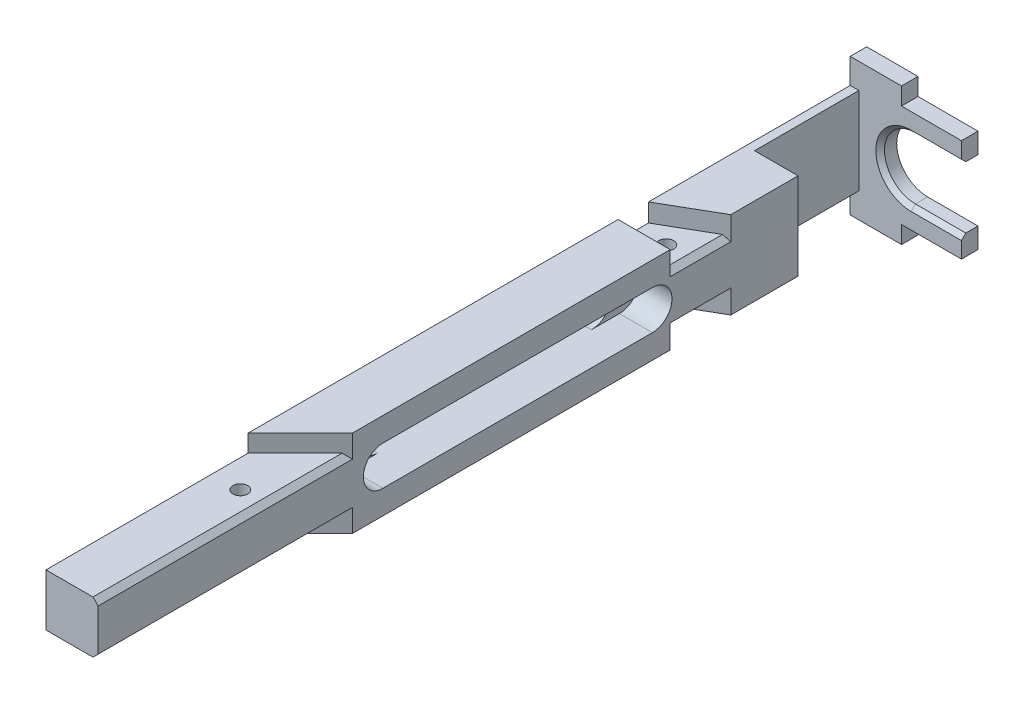
from build123d import *

# Parameters (mm, degrees)
EXTRUDE_1_DEPTH     = 6
CUT_EXTRUDE_1_DEPTH = 3.8
CUT_EXTRUDE_2_DEPTH = 49.87803699
SKETCH_3_W          = 18.536502565
SKETCH_3_H          = 15.637579157
CUT_EXTRUDE_3_DEPTH = 4
SKETCH_4_W          = 6
SKETCH_4_H          = 10
EXTRUDE_2_DEPTH     = 19.25
SKETCH_5_R          = 0.85
CUT_EXTRUDE_4_DEPTH = 50.639324129
SKETCH_7_W          = 12.8
SKETCH_7_H          = 11.8
EXTRUDE_3_DEPTH     = 1.9
SKETCH_8_W          = 12
SKETCH_8_H          = 10
CUT_EXTRUDE_5_DEPTH = 5
CUT_EXTRUDE_6_DEPTH = 5
CHAMFER_1_SIZE      = 0.5
SKETCH_10_W         = 1.9
SKETCH_10_H         = 2
EXTRUDE_4_DEPTH     = 5.9
CHAMFER_2_SIZE      = 6
CUT_EXTRUDE_7_DEPTH = 2.1
CUT_EXTRUDE_START   = -10
CUT_EXTRUDE_8_DEPTH = 2.1
CHAMFER_3_SIZE      = 0.6


with BuildPart() as part:
    # 草图1 → 凸台-拉伸1 (new body)
    with BuildSketch(Plane(origin=(0, 0, 0), x_dir=(0, 0, -1), z_dir=(1, 0, 0))):
        Polygon((-25, 5), (25, 5), (25, 3), (48.25, 3), (48.25, -3), (25, -3), (25, -5), (-25, -5), (-25, -3), (-48.25, -3), (-48.25, 3), (-25, 3), align=None)
    extrude(amount=-EXTRUDE_1_DEPTH)

    # 草图1<3> → 切除-拉伸1 (cut)
    with BuildSketch(Plane(origin=(0, 0, 0), x_dir=(0, 0, -1), z_dir=(1, 0, 0))):
        with BuildLine():
            Line((-15.5, 2.25), (15.5, 2.25))
            ThreePointArc((15.5, 2.25), (17.75, 0), (15.5, -2.25))
            Line((15.5, -2.25), (-15.5, -2.25))
            ThreePointArc((-15.5, -2.25), (-17.75, 0), (-15.5, 2.25))
        make_face()
    extrude(amount=-CUT_EXTRUDE_1_DEPTH, mode=Mode.SUBTRACT)

    # 草图1<4> → 切除-拉伸2 (cut, through all)
    with BuildSketch(Plane(origin=(0, 0, 0), x_dir=(0, 0, -1), z_dir=(1, 0, 0))):
        with BuildLine():
            Line((-12.3, 2.25), (12.3, 2.25))
            ThreePointArc((12.3, 2.25), (14.55, 0), (12.3, -2.25))
            Line((12.3, -2.25), (-12.3, -2.25))
            ThreePointArc((-12.3, -2.25), (-14.55, 0), (-12.3, 2.25))
        make_face()
    extrude(amount=-CUT_EXTRUDE_2_DEPTH, mode=Mode.SUBTRACT)

    # 草图3 → 切除-拉伸3 (cut)
    with BuildSketch(Plane(origin=(0, 0, -48.25), x_dir=(-1, 0, 0), z_dir=(0, 0, -1))):
        with Locations((1.626975839, 1.766046581)):
            Rectangle(SKETCH_3_W, SKETCH_3_H)
    extrude(amount=-CUT_EXTRUDE_3_DEPTH, mode=Mode.SUBTRACT)

    # 草图4 → 凸台-拉伸2 (add)
    with BuildSketch(Plane(origin=(0, 0, -25), x_dir=(-1, 0, 0), z_dir=(0, 0, -1))):
        with Locations((3, 0)):
            Rectangle(SKETCH_4_W, SKETCH_4_H)
    extrude(amount=EXTRUDE_2_DEPTH)

    # 草图5 → 切除-拉伸4 (cut, through all)
    with BuildSketch(Plane.XZ.offset(5)):
        with Locations(Location((-2.8, 29.1, 0), (0, 0, 270))):
            Circle(SKETCH_5_R)
        with Locations(Location((-2.8, -19.9, 0), (0, 0, 270))):
            Circle(SKETCH_5_R)
    extrude(amount=-CUT_EXTRUDE_4_DEPTH, mode=Mode.SUBTRACT)

    # 草图7 → 凸台-拉伸3 (add)
    with BuildSketch(Plane(origin=(0, 0, -44.25), x_dir=(-1, 0, 0), z_dir=(0, 0, -1))):
        with Locations((-0.4, 0)):
            Rectangle(SKETCH_7_W, SKETCH_7_H)
    extrude(amount=EXTRUDE_3_DEPTH)

    # 草图8 → 切除-拉伸5 (cut)
    with BuildSketch(Plane(origin=(0, 0, 0), x_dir=(0, 0, -1), z_dir=(1, 0, 0))):
        with Locations((38.25, 0)):
            Rectangle(SKETCH_8_W, SKETCH_8_H)
    extrude(amount=-CUT_EXTRUDE_5_DEPTH, mode=Mode.SUBTRACT)

    # 草图9 → 切除-拉伸6 (cut)
    with BuildSketch(Plane.XY.offset(-44.25)):
        with BuildLine():
            Line((12.6, -3.55), (1, -3.55))
            ThreePointArc((1, -3.55), (-2.55, 0), (1, 3.55))
            Line((1, 3.55), (12.6, 3.55))
            ThreePointArc((12.6, 3.55), (16.15, 0), (12.6, -3.55))
        make_face()
    extrude(amount=-CUT_EXTRUDE_6_DEPTH, mode=Mode.SUBTRACT)

    # 倒角1
    chamfer_1_edges = [part.edges().sort_by_distance(p)[0] for p in [
        (3.9, 3.55, -44.25),
        (3.9, -3.55, -44.25),
        (-2.55, 0, -44.25),
    ]]
    chamfer(chamfer_1_edges, length=CHAMFER_1_SIZE)

    # 草图10 → 凸台-拉伸4 (add)
    with BuildSketch(Plane.ZY.offset(6)):
        with Locations((-45.2, 6.9)):
            Rectangle(SKETCH_10_W, SKETCH_10_H)
        with Locations((-45.2, -6.9)):
            Rectangle(SKETCH_10_W, SKETCH_10_H)
    extrude(amount=-EXTRUDE_4_DEPTH)

    # 倒角2
    chamfer_2_edges = [part.edges().sort_by_distance(p)[0] for p in [
        (0, 4, 25),
        (0, -4, 25),
    ]]
    chamfer(chamfer_2_edges, length=CHAMFER_2_SIZE - 0.0001)  # a hair under: the kernel refuses the full size

    # 草图11 → 切除-拉伸7 (cut)
    with BuildSketch(Plane(origin=(0, 5, 0), x_dir=(1, 0, 0), z_dir=(0, 1, 0))):
        Polygon((0, 24.514101615), (-6, 21.05), (-6, 17.55), (0, 17.55), align=None)
    extrude(amount=-CUT_EXTRUDE_7_DEPTH, mode=Mode.SUBTRACT)

    # 草图11<2> → 切除-拉伸8 (cut)
    with BuildSketch(Plane(origin=(0, 5, 0), x_dir=(1, 0, 0), z_dir=(0, 1, 0)).offset(CUT_EXTRUDE_START)):
        Polygon((0, 24.514101615), (-6, 21.05), (-6, 17.55), (0, 17.55), align=None)
    extrude(amount=CUT_EXTRUDE_8_DEPTH, mode=Mode.SUBTRACT)

    # 倒角3
    chamfer_3_edges = [part.edges().sort_by_distance(p)[0] for p in [
        (0, 3, 33.62505),
        (0, -3, 33.62505),
        (0, 2.9, -21.032050808),
        (0, -2.9, -21.032050808),
    ]]
    chamfer(chamfer_3_edges, length=CHAMFER_3_SIZE)


solid = part.part
